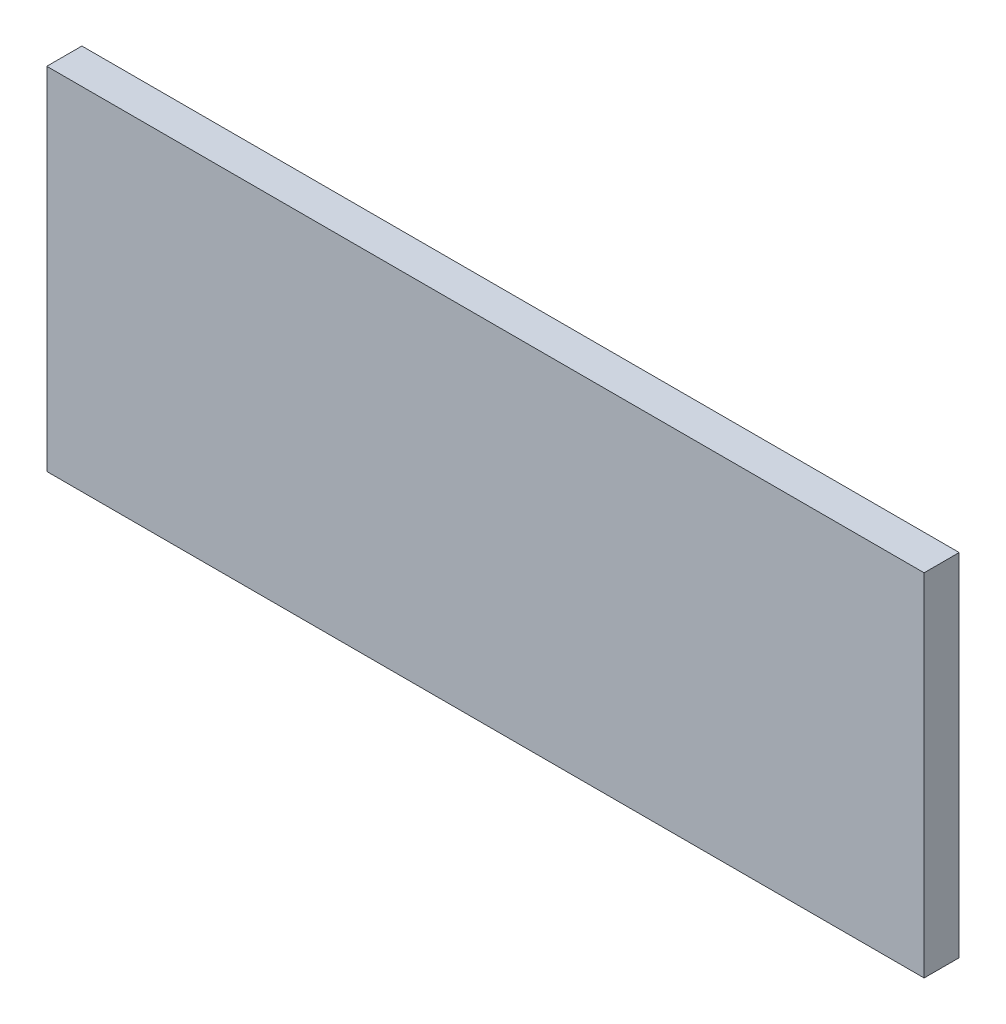
from build123d import *

# Parameters (mm, degrees)
SKETCH_1_W             = 100
SKETCH_1_H             = 40
SM_BASE_FLANGE_1_DEPTH = 4


# Sheet-metal steps are written as plain solids
with BuildPart() as part:
    # Sketch 1 → Sm Base Flange 1 (new body)
    with BuildSketch(Plane.XY):
        Rectangle(SKETCH_1_W, SKETCH_1_H)
    extrude(amount=-SM_BASE_FLANGE_1_DEPTH)


solid = part.part
